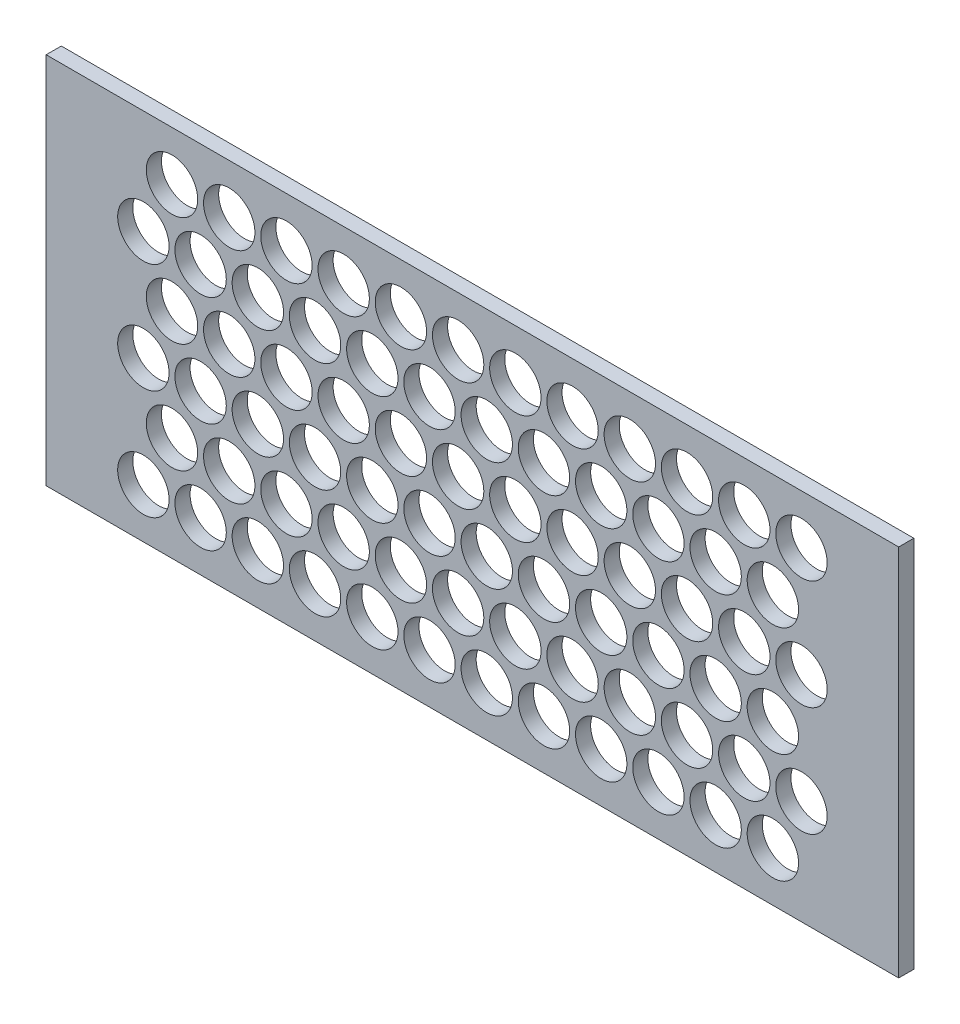
from build123d import *

# Parameters (mm, degrees)
SKETCH1_W                  = 357.55
SKETCH1_H                  = 156.55
BOSS_EXTRUDE1_DEPTH        = 6.35
CUT_EXTRUDE1_DEPTH         = 196.26340863
SKETCH4_R                  = 10.775
CUT_EXTRUDE2_DEPTH         = 196.26340863
LPATTERN1_COUNT            = 12
LPATTERN1_PITCH            = 24
LPATTERN2_COPY_1_DEPTH     = 196.26340863
LPATTERN2_COPY_2_DEPTH     = 196.26340863
LPATTERN2_COPY_3_DEPTH     = 196.26340863
LPATTERN2_COPY_4_DEPTH     = 196.26340863
LPATTERN2_COPY_5_DEPTH     = 196.26340863
LPATTERN2_COPY_6_DEPTH     = 196.26340863
LPATTERN2_COPY_7_DEPTH     = 196.26340863
LPATTERN2_COPY_8_DEPTH     = 196.26340863
LPATTERN2_COPY_9_DEPTH     = 196.26340863
LPATTERN2_COPY_10_DEPTH    = 196.26340863
LPATTERN2_COPY_11_DEPTH    = 196.26340863
LPATTERN2_COPY_12_DEPTH    = 196.26340863
LPATTERN2_COPY_13_DEPTH    = 196.26340863
LPATTERN2_COPY_14_DEPTH    = 196.26340863
LPATTERN2_COPY_15_DEPTH    = 196.26340863
LPATTERN2_COPY_16_DEPTH    = 196.26340863
LPATTERN2_COPY_17_DEPTH    = 196.26340863
LPATTERN2_COPY_18_DEPTH    = 196.26340863
LPATTERN2_COPY_19_DEPTH    = 196.26340863
LPATTERN2_COPY_20_DEPTH    = 196.26340863
LPATTERN2_COPY_21_DEPTH    = 196.26340863
LPATTERN2_COPY_22_DEPTH    = 196.26340863
LPATTERN2_COPY_23_SKETCH_R = 10.775
LPATTERN2_COPY_23_DEPTH    = 196.26340863
LPATTERN2_COPY_24_SKETCH_R = 10.775
LPATTERN2_COPY_24_DEPTH    = 196.26340863
LPATTERN2_COPY_25_SKETCH_R = 10.775
LPATTERN2_COPY_25_DEPTH    = 196.26340863
LPATTERN2_COPY_26_SKETCH_R = 10.775
LPATTERN2_COPY_26_DEPTH    = 196.26340863
LPATTERN2_COPY_27_SKETCH_R = 10.775
LPATTERN2_COPY_27_DEPTH    = 196.26340863
LPATTERN2_COPY_28_SKETCH_R = 10.775
LPATTERN2_COPY_28_DEPTH    = 196.26340863
LPATTERN2_COPY_29_SKETCH_R = 10.775
LPATTERN2_COPY_29_DEPTH    = 196.26340863
LPATTERN2_COPY_30_SKETCH_R = 10.775
LPATTERN2_COPY_30_DEPTH    = 196.26340863
LPATTERN2_COPY_31_SKETCH_R = 10.775
LPATTERN2_COPY_31_DEPTH    = 196.26340863
LPATTERN2_COPY_32_SKETCH_R = 10.775
LPATTERN2_COPY_32_DEPTH    = 196.26340863
LPATTERN2_COPY_33_SKETCH_R = 10.775
LPATTERN2_COPY_33_DEPTH    = 196.26340863
LPATTERN2_COPY_34_SKETCH_R = 10.775
LPATTERN2_COPY_34_DEPTH    = 196.26340863
LPATTERN2_COPY_35_SKETCH_R = 10.775
LPATTERN2_COPY_35_DEPTH    = 196.26340863
LPATTERN2_COPY_36_SKETCH_R = 10.775
LPATTERN2_COPY_36_DEPTH    = 196.26340863
LPATTERN2_COPY_37_SKETCH_R = 10.775
LPATTERN2_COPY_37_DEPTH    = 196.26340863
LPATTERN2_COPY_38_SKETCH_R = 10.775
LPATTERN2_COPY_38_DEPTH    = 196.26340863
LPATTERN2_COPY_39_SKETCH_R = 10.775
LPATTERN2_COPY_39_DEPTH    = 196.26340863
LPATTERN2_COPY_40_SKETCH_R = 10.775
LPATTERN2_COPY_40_DEPTH    = 196.26340863
LPATTERN2_COPY_41_SKETCH_R = 10.775
LPATTERN2_COPY_41_DEPTH    = 196.26340863
LPATTERN2_COPY_42_SKETCH_R = 10.775
LPATTERN2_COPY_42_DEPTH    = 196.26340863
LPATTERN2_COPY_43_SKETCH_R = 10.775
LPATTERN2_COPY_43_DEPTH    = 196.26340863
LPATTERN2_COPY_44_SKETCH_R = 10.775
LPATTERN2_COPY_44_DEPTH    = 196.26340863
LPATTERN2_COPY_45_DEPTH    = 196.26340863
LPATTERN2_COPY_46_DEPTH    = 196.26340863
LPATTERN2_COPY_47_SKETCH_R = 10.775
LPATTERN2_COPY_47_DEPTH    = 196.26340863
LPATTERN2_COPY_48_SKETCH_R = 10.775
LPATTERN2_COPY_48_DEPTH    = 196.26340863


with BuildPart() as part:
    # Sketch1 → Boss-Extrude1 (new body)
    with BuildSketch(Plane.XY):
        Rectangle(SKETCH1_W, SKETCH1_H)
    extrude(amount=BOSS_EXTRUDE1_DEPTH)

    # Sketch3 → Cut-Extrude1 (cut, through all)
    with BuildSketch(Plane.XY.offset(6.35)):
        with BuildLine():
            ThreePointArc((-127.225, -57.5), (-137.999999978, -46.725), (-148.775, -57.499999955))
            ThreePointArc((-148.775, -57.499999955), (-145.619075583, -65.119075551), (-138, -68.275))
            ThreePointArc((-138, -68.275), (-130.380924433, -65.119075567), (-127.225, -57.5))
        make_face()
    cut_extrude1 = extrude(amount=-CUT_EXTRUDE1_DEPTH, mode=Mode.SUBTRACT)

    # Sketch4 → Cut-Extrude2 (cut, through all)
    with BuildSketch(Plane.XY.offset(6.35)):
        with Locations((-126, -34.5)):
            Circle(SKETCH4_R)
    cut_extrude2 = extrude(amount=-CUT_EXTRUDE2_DEPTH, mode=Mode.SUBTRACT)

    # LPattern1: Cut-Extrude1, Cut-Extrude2 ×12
    with Locations(*[(i * LPATTERN1_PITCH, 0, 0) for i in range(1, LPATTERN1_COUNT)]):
        add(cut_extrude1, mode=Mode.SUBTRACT)
        add(cut_extrude2, mode=Mode.SUBTRACT)

    # LPattern2 copy 1 sketch → LPattern2 copy 1 (cut, through all)
    with BuildSketch(Plane(origin=(24, 46, 6.35), x_dir=(1, 0, 0), z_dir=(0, 0, 1))):
        with BuildLine():
            ThreePointArc((-127.225, -57.5), (-137.999999978, -46.725), (-148.775, -57.499999955))
            ThreePointArc((-148.775, -57.499999955), (-145.619075583, -65.119075551), (-138, -68.275))
            ThreePointArc((-138, -68.275), (-130.380924433, -65.119075567), (-127.225, -57.5))
        make_face()
    extrude(amount=-LPATTERN2_COPY_1_DEPTH, mode=Mode.SUBTRACT)

    # LPattern2 copy 2 sketch → LPattern2 copy 2 (cut, through all)
    with BuildSketch(Plane(origin=(24, 92, 6.35), x_dir=(1, 0, 0), z_dir=(0, 0, 1))):
        with BuildLine():
            ThreePointArc((-127.225, -57.5), (-137.999999978, -46.725), (-148.775, -57.499999955))
            ThreePointArc((-148.775, -57.499999955), (-145.619075583, -65.119075551), (-138, -68.275))
            ThreePointArc((-138, -68.275), (-130.380924433, -65.119075567), (-127.225, -57.5))
        make_face()
    extrude(amount=-LPATTERN2_COPY_2_DEPTH, mode=Mode.SUBTRACT)

    # LPattern2 copy 3 sketch → LPattern2 copy 3 (cut, through all)
    with BuildSketch(Plane(origin=(48, 46, 6.35), x_dir=(1, 0, 0), z_dir=(0, 0, 1))):
        with BuildLine():
            ThreePointArc((-127.225, -57.5), (-137.999999978, -46.725), (-148.775, -57.499999955))
            ThreePointArc((-148.775, -57.499999955), (-145.619075583, -65.119075551), (-138, -68.275))
            ThreePointArc((-138, -68.275), (-130.380924433, -65.119075567), (-127.225, -57.5))
        make_face()
    extrude(amount=-LPATTERN2_COPY_3_DEPTH, mode=Mode.SUBTRACT)

    # LPattern2 copy 4 sketch → LPattern2 copy 4 (cut, through all)
    with BuildSketch(Plane(origin=(48, 92, 6.35), x_dir=(1, 0, 0), z_dir=(0, 0, 1))):
        with BuildLine():
            ThreePointArc((-127.225, -57.5), (-137.999999978, -46.725), (-148.775, -57.499999955))
            ThreePointArc((-148.775, -57.499999955), (-145.619075583, -65.119075551), (-138, -68.275))
            ThreePointArc((-138, -68.275), (-130.380924433, -65.119075567), (-127.225, -57.5))
        make_face()
    extrude(amount=-LPATTERN2_COPY_4_DEPTH, mode=Mode.SUBTRACT)

    # LPattern2 copy 5 sketch → LPattern2 copy 5 (cut, through all)
    with BuildSketch(Plane(origin=(72, 46, 6.35), x_dir=(1, 0, 0), z_dir=(0, 0, 1))):
        with BuildLine():
            ThreePointArc((-127.225, -57.5), (-137.999999978, -46.725), (-148.775, -57.499999955))
            ThreePointArc((-148.775, -57.499999955), (-145.619075583, -65.119075551), (-138, -68.275))
            ThreePointArc((-138, -68.275), (-130.380924433, -65.119075567), (-127.225, -57.5))
        make_face()
    extrude(amount=-LPATTERN2_COPY_5_DEPTH, mode=Mode.SUBTRACT)

    # LPattern2 copy 6 sketch → LPattern2 copy 6 (cut, through all)
    with BuildSketch(Plane(origin=(72, 92, 6.35), x_dir=(1, 0, 0), z_dir=(0, 0, 1))):
        with BuildLine():
            ThreePointArc((-127.225, -57.5), (-137.999999978, -46.725), (-148.775, -57.499999955))
            ThreePointArc((-148.775, -57.499999955), (-145.619075583, -65.119075551), (-138, -68.275))
            ThreePointArc((-138, -68.275), (-130.380924433, -65.119075567), (-127.225, -57.5))
        make_face()
    extrude(amount=-LPATTERN2_COPY_6_DEPTH, mode=Mode.SUBTRACT)

    # LPattern2 copy 7 sketch → LPattern2 copy 7 (cut, through all)
    with BuildSketch(Plane(origin=(96, 46, 6.35), x_dir=(1, 0, 0), z_dir=(0, 0, 1))):
        with BuildLine():
            ThreePointArc((-127.225, -57.5), (-137.999999978, -46.725), (-148.775, -57.499999955))
            ThreePointArc((-148.775, -57.499999955), (-145.619075583, -65.119075551), (-138, -68.275))
            ThreePointArc((-138, -68.275), (-130.380924433, -65.119075567), (-127.225, -57.5))
        make_face()
    extrude(amount=-LPATTERN2_COPY_7_DEPTH, mode=Mode.SUBTRACT)

    # LPattern2 copy 8 sketch → LPattern2 copy 8 (cut, through all)
    with BuildSketch(Plane(origin=(96, 92, 6.35), x_dir=(1, 0, 0), z_dir=(0, 0, 1))):
        with BuildLine():
            ThreePointArc((-127.225, -57.5), (-137.999999978, -46.725), (-148.775, -57.499999955))
            ThreePointArc((-148.775, -57.499999955), (-145.619075583, -65.119075551), (-138, -68.275))
            ThreePointArc((-138, -68.275), (-130.380924433, -65.119075567), (-127.225, -57.5))
        make_face()
    extrude(amount=-LPATTERN2_COPY_8_DEPTH, mode=Mode.SUBTRACT)

    # LPattern2 copy 9 sketch → LPattern2 copy 9 (cut, through all)
    with BuildSketch(Plane(origin=(120, 46, 6.35), x_dir=(1, 0, 0), z_dir=(0, 0, 1))):
        with BuildLine():
            ThreePointArc((-127.225, -57.5), (-137.999999978, -46.725), (-148.775, -57.499999955))
            ThreePointArc((-148.775, -57.499999955), (-145.619075583, -65.119075551), (-138, -68.275))
            ThreePointArc((-138, -68.275), (-130.380924433, -65.119075567), (-127.225, -57.5))
        make_face()
    extrude(amount=-LPATTERN2_COPY_9_DEPTH, mode=Mode.SUBTRACT)

    # LPattern2 copy 10 sketch → LPattern2 copy 10 (cut, through all)
    with BuildSketch(Plane(origin=(120, 92, 6.35), x_dir=(1, 0, 0), z_dir=(0, 0, 1))):
        with BuildLine():
            ThreePointArc((-127.225, -57.5), (-137.999999978, -46.725), (-148.775, -57.499999955))
            ThreePointArc((-148.775, -57.499999955), (-145.619075583, -65.119075551), (-138, -68.275))
            ThreePointArc((-138, -68.275), (-130.380924433, -65.119075567), (-127.225, -57.5))
        make_face()
    extrude(amount=-LPATTERN2_COPY_10_DEPTH, mode=Mode.SUBTRACT)

    # LPattern2 copy 11 sketch → LPattern2 copy 11 (cut, through all)
    with BuildSketch(Plane(origin=(144, 46, 6.35), x_dir=(1, 0, 0), z_dir=(0, 0, 1))):
        with BuildLine():
            ThreePointArc((-127.225, -57.5), (-137.999999978, -46.725), (-148.775, -57.499999955))
            ThreePointArc((-148.775, -57.499999955), (-145.619075583, -65.119075551), (-138, -68.275))
            ThreePointArc((-138, -68.275), (-130.380924433, -65.119075567), (-127.225, -57.5))
        make_face()
    extrude(amount=-LPATTERN2_COPY_11_DEPTH, mode=Mode.SUBTRACT)

    # LPattern2 copy 12 sketch → LPattern2 copy 12 (cut, through all)
    with BuildSketch(Plane(origin=(144, 92, 6.35), x_dir=(1, 0, 0), z_dir=(0, 0, 1))):
        with BuildLine():
            ThreePointArc((-127.225, -57.5), (-137.999999978, -46.725), (-148.775, -57.499999955))
            ThreePointArc((-148.775, -57.499999955), (-145.619075583, -65.119075551), (-138, -68.275))
            ThreePointArc((-138, -68.275), (-130.380924433, -65.119075567), (-127.225, -57.5))
        make_face()
    extrude(amount=-LPATTERN2_COPY_12_DEPTH, mode=Mode.SUBTRACT)

    # LPattern2 copy 13 sketch → LPattern2 copy 13 (cut, through all)
    with BuildSketch(Plane(origin=(168, 46, 6.35), x_dir=(1, 0, 0), z_dir=(0, 0, 1))):
        with BuildLine():
            ThreePointArc((-127.225, -57.5), (-137.999999978, -46.725), (-148.775, -57.499999955))
            ThreePointArc((-148.775, -57.499999955), (-145.619075583, -65.119075551), (-138, -68.275))
            ThreePointArc((-138, -68.275), (-130.380924433, -65.119075567), (-127.225, -57.5))
        make_face()
    extrude(amount=-LPATTERN2_COPY_13_DEPTH, mode=Mode.SUBTRACT)

    # LPattern2 copy 14 sketch → LPattern2 copy 14 (cut, through all)
    with BuildSketch(Plane(origin=(168, 92, 6.35), x_dir=(1, 0, 0), z_dir=(0, 0, 1))):
        with BuildLine():
            ThreePointArc((-127.225, -57.5), (-137.999999978, -46.725), (-148.775, -57.499999955))
            ThreePointArc((-148.775, -57.499999955), (-145.619075583, -65.119075551), (-138, -68.275))
            ThreePointArc((-138, -68.275), (-130.380924433, -65.119075567), (-127.225, -57.5))
        make_face()
    extrude(amount=-LPATTERN2_COPY_14_DEPTH, mode=Mode.SUBTRACT)

    # LPattern2 copy 15 sketch → LPattern2 copy 15 (cut, through all)
    with BuildSketch(Plane(origin=(192, 46, 6.35), x_dir=(1, 0, 0), z_dir=(0, 0, 1))):
        with BuildLine():
            ThreePointArc((-127.225, -57.5), (-137.999999978, -46.725), (-148.775, -57.499999955))
            ThreePointArc((-148.775, -57.499999955), (-145.619075583, -65.119075551), (-138, -68.275))
            ThreePointArc((-138, -68.275), (-130.380924433, -65.119075567), (-127.225, -57.5))
        make_face()
    extrude(amount=-LPATTERN2_COPY_15_DEPTH, mode=Mode.SUBTRACT)

    # LPattern2 copy 16 sketch → LPattern2 copy 16 (cut, through all)
    with BuildSketch(Plane(origin=(192, 92, 6.35), x_dir=(1, 0, 0), z_dir=(0, 0, 1))):
        with BuildLine():
            ThreePointArc((-127.225, -57.5), (-137.999999978, -46.725), (-148.775, -57.499999955))
            ThreePointArc((-148.775, -57.499999955), (-145.619075583, -65.119075551), (-138, -68.275))
            ThreePointArc((-138, -68.275), (-130.380924433, -65.119075567), (-127.225, -57.5))
        make_face()
    extrude(amount=-LPATTERN2_COPY_16_DEPTH, mode=Mode.SUBTRACT)

    # LPattern2 copy 17 sketch → LPattern2 copy 17 (cut, through all)
    with BuildSketch(Plane(origin=(216, 46, 6.35), x_dir=(1, 0, 0), z_dir=(0, 0, 1))):
        with BuildLine():
            ThreePointArc((-127.225, -57.5), (-137.999999978, -46.725), (-148.775, -57.499999955))
            ThreePointArc((-148.775, -57.499999955), (-145.619075583, -65.119075551), (-138, -68.275))
            ThreePointArc((-138, -68.275), (-130.380924433, -65.119075567), (-127.225, -57.5))
        make_face()
    extrude(amount=-LPATTERN2_COPY_17_DEPTH, mode=Mode.SUBTRACT)

    # LPattern2 copy 18 sketch → LPattern2 copy 18 (cut, through all)
    with BuildSketch(Plane(origin=(216, 92, 6.35), x_dir=(1, 0, 0), z_dir=(0, 0, 1))):
        with BuildLine():
            ThreePointArc((-127.225, -57.5), (-137.999999978, -46.725), (-148.775, -57.499999955))
            ThreePointArc((-148.775, -57.499999955), (-145.619075583, -65.119075551), (-138, -68.275))
            ThreePointArc((-138, -68.275), (-130.380924433, -65.119075567), (-127.225, -57.5))
        make_face()
    extrude(amount=-LPATTERN2_COPY_18_DEPTH, mode=Mode.SUBTRACT)

    # LPattern2 copy 19 sketch → LPattern2 copy 19 (cut, through all)
    with BuildSketch(Plane(origin=(240, 46, 6.35), x_dir=(1, 0, 0), z_dir=(0, 0, 1))):
        with BuildLine():
            ThreePointArc((-127.225, -57.5), (-137.999999978, -46.725), (-148.775, -57.499999955))
            ThreePointArc((-148.775, -57.499999955), (-145.619075583, -65.119075551), (-138, -68.275))
            ThreePointArc((-138, -68.275), (-130.380924433, -65.119075567), (-127.225, -57.5))
        make_face()
    extrude(amount=-LPATTERN2_COPY_19_DEPTH, mode=Mode.SUBTRACT)

    # LPattern2 copy 20 sketch → LPattern2 copy 20 (cut, through all)
    with BuildSketch(Plane(origin=(240, 92, 6.35), x_dir=(1, 0, 0), z_dir=(0, 0, 1))):
        with BuildLine():
            ThreePointArc((-127.225, -57.5), (-137.999999978, -46.725), (-148.775, -57.499999955))
            ThreePointArc((-148.775, -57.499999955), (-145.619075583, -65.119075551), (-138, -68.275))
            ThreePointArc((-138, -68.275), (-130.380924433, -65.119075567), (-127.225, -57.5))
        make_face()
    extrude(amount=-LPATTERN2_COPY_20_DEPTH, mode=Mode.SUBTRACT)

    # LPattern2 copy 21 sketch → LPattern2 copy 21 (cut, through all)
    with BuildSketch(Plane(origin=(264, 46, 6.35), x_dir=(1, 0, 0), z_dir=(0, 0, 1))):
        with BuildLine():
            ThreePointArc((-127.225, -57.5), (-137.999999978, -46.725), (-148.775, -57.499999955))
            ThreePointArc((-148.775, -57.499999955), (-145.619075583, -65.119075551), (-138, -68.275))
            ThreePointArc((-138, -68.275), (-130.380924433, -65.119075567), (-127.225, -57.5))
        make_face()
    extrude(amount=-LPATTERN2_COPY_21_DEPTH, mode=Mode.SUBTRACT)

    # LPattern2 copy 22 sketch → LPattern2 copy 22 (cut, through all)
    with BuildSketch(Plane(origin=(264, 92, 6.35), x_dir=(1, 0, 0), z_dir=(0, 0, 1))):
        with BuildLine():
            ThreePointArc((-127.225, -57.5), (-137.999999978, -46.725), (-148.775, -57.499999955))
            ThreePointArc((-148.775, -57.499999955), (-145.619075583, -65.119075551), (-138, -68.275))
            ThreePointArc((-138, -68.275), (-130.380924433, -65.119075567), (-127.225, -57.5))
        make_face()
    extrude(amount=-LPATTERN2_COPY_22_DEPTH, mode=Mode.SUBTRACT)

    # LPattern2 copy 23 sketch → LPattern2 copy 23 (cut, through all)
    with BuildSketch(Plane(origin=(24, 46, 6.35), x_dir=(1, 0, 0), z_dir=(0, 0, 1))):
        with Locations((-126, -34.5)):
            Circle(LPATTERN2_COPY_23_SKETCH_R)
    extrude(amount=-LPATTERN2_COPY_23_DEPTH, mode=Mode.SUBTRACT)

    # LPattern2 copy 24 sketch → LPattern2 copy 24 (cut, through all)
    with BuildSketch(Plane(origin=(24, 92, 6.35), x_dir=(1, 0, 0), z_dir=(0, 0, 1))):
        with Locations((-126, -34.5)):
            Circle(LPATTERN2_COPY_24_SKETCH_R)
    extrude(amount=-LPATTERN2_COPY_24_DEPTH, mode=Mode.SUBTRACT)

    # LPattern2 copy 25 sketch → LPattern2 copy 25 (cut, through all)
    with BuildSketch(Plane(origin=(48, 46, 6.35), x_dir=(1, 0, 0), z_dir=(0, 0, 1))):
        with Locations((-126, -34.5)):
            Circle(LPATTERN2_COPY_25_SKETCH_R)
    extrude(amount=-LPATTERN2_COPY_25_DEPTH, mode=Mode.SUBTRACT)

    # LPattern2 copy 26 sketch → LPattern2 copy 26 (cut, through all)
    with BuildSketch(Plane(origin=(48, 92, 6.35), x_dir=(1, 0, 0), z_dir=(0, 0, 1))):
        with Locations((-126, -34.5)):
            Circle(LPATTERN2_COPY_26_SKETCH_R)
    extrude(amount=-LPATTERN2_COPY_26_DEPTH, mode=Mode.SUBTRACT)

    # LPattern2 copy 27 sketch → LPattern2 copy 27 (cut, through all)
    with BuildSketch(Plane(origin=(72, 46, 6.35), x_dir=(1, 0, 0), z_dir=(0, 0, 1))):
        with Locations((-126, -34.5)):
            Circle(LPATTERN2_COPY_27_SKETCH_R)
    extrude(amount=-LPATTERN2_COPY_27_DEPTH, mode=Mode.SUBTRACT)

    # LPattern2 copy 28 sketch → LPattern2 copy 28 (cut, through all)
    with BuildSketch(Plane(origin=(72, 92, 6.35), x_dir=(1, 0, 0), z_dir=(0, 0, 1))):
        with Locations((-126, -34.5)):
            Circle(LPATTERN2_COPY_28_SKETCH_R)
    extrude(amount=-LPATTERN2_COPY_28_DEPTH, mode=Mode.SUBTRACT)

    # LPattern2 copy 29 sketch → LPattern2 copy 29 (cut, through all)
    with BuildSketch(Plane(origin=(96, 46, 6.35), x_dir=(1, 0, 0), z_dir=(0, 0, 1))):
        with Locations((-126, -34.5)):
            Circle(LPATTERN2_COPY_29_SKETCH_R)
    extrude(amount=-LPATTERN2_COPY_29_DEPTH, mode=Mode.SUBTRACT)

    # LPattern2 copy 30 sketch → LPattern2 copy 30 (cut, through all)
    with BuildSketch(Plane(origin=(96, 92, 6.35), x_dir=(1, 0, 0), z_dir=(0, 0, 1))):
        with Locations((-126, -34.5)):
            Circle(LPATTERN2_COPY_30_SKETCH_R)
    extrude(amount=-LPATTERN2_COPY_30_DEPTH, mode=Mode.SUBTRACT)

    # LPattern2 copy 31 sketch → LPattern2 copy 31 (cut, through all)
    with BuildSketch(Plane(origin=(120, 46, 6.35), x_dir=(1, 0, 0), z_dir=(0, 0, 1))):
        with Locations((-126, -34.5)):
            Circle(LPATTERN2_COPY_31_SKETCH_R)
    extrude(amount=-LPATTERN2_COPY_31_DEPTH, mode=Mode.SUBTRACT)

    # LPattern2 copy 32 sketch → LPattern2 copy 32 (cut, through all)
    with BuildSketch(Plane(origin=(120, 92, 6.35), x_dir=(1, 0, 0), z_dir=(0, 0, 1))):
        with Locations((-126, -34.5)):
            Circle(LPATTERN2_COPY_32_SKETCH_R)
    extrude(amount=-LPATTERN2_COPY_32_DEPTH, mode=Mode.SUBTRACT)

    # LPattern2 copy 33 sketch → LPattern2 copy 33 (cut, through all)
    with BuildSketch(Plane(origin=(144, 46, 6.35), x_dir=(1, 0, 0), z_dir=(0, 0, 1))):
        with Locations((-126, -34.5)):
            Circle(LPATTERN2_COPY_33_SKETCH_R)
    extrude(amount=-LPATTERN2_COPY_33_DEPTH, mode=Mode.SUBTRACT)

    # LPattern2 copy 34 sketch → LPattern2 copy 34 (cut, through all)
    with BuildSketch(Plane(origin=(144, 92, 6.35), x_dir=(1, 0, 0), z_dir=(0, 0, 1))):
        with Locations((-126, -34.5)):
            Circle(LPATTERN2_COPY_34_SKETCH_R)
    extrude(amount=-LPATTERN2_COPY_34_DEPTH, mode=Mode.SUBTRACT)

    # LPattern2 copy 35 sketch → LPattern2 copy 35 (cut, through all)
    with BuildSketch(Plane(origin=(168, 46, 6.35), x_dir=(1, 0, 0), z_dir=(0, 0, 1))):
        with Locations((-126, -34.5)):
            Circle(LPATTERN2_COPY_35_SKETCH_R)
    extrude(amount=-LPATTERN2_COPY_35_DEPTH, mode=Mode.SUBTRACT)

    # LPattern2 copy 36 sketch → LPattern2 copy 36 (cut, through all)
    with BuildSketch(Plane(origin=(168, 92, 6.35), x_dir=(1, 0, 0), z_dir=(0, 0, 1))):
        with Locations((-126, -34.5)):
            Circle(LPATTERN2_COPY_36_SKETCH_R)
    extrude(amount=-LPATTERN2_COPY_36_DEPTH, mode=Mode.SUBTRACT)

    # LPattern2 copy 37 sketch → LPattern2 copy 37 (cut, through all)
    with BuildSketch(Plane(origin=(192, 46, 6.35), x_dir=(1, 0, 0), z_dir=(0, 0, 1))):
        with Locations((-126, -34.5)):
            Circle(LPATTERN2_COPY_37_SKETCH_R)
    extrude(amount=-LPATTERN2_COPY_37_DEPTH, mode=Mode.SUBTRACT)

    # LPattern2 copy 38 sketch → LPattern2 copy 38 (cut, through all)
    with BuildSketch(Plane(origin=(192, 92, 6.35), x_dir=(1, 0, 0), z_dir=(0, 0, 1))):
        with Locations((-126, -34.5)):
            Circle(LPATTERN2_COPY_38_SKETCH_R)
    extrude(amount=-LPATTERN2_COPY_38_DEPTH, mode=Mode.SUBTRACT)

    # LPattern2 copy 39 sketch → LPattern2 copy 39 (cut, through all)
    with BuildSketch(Plane(origin=(216, 46, 6.35), x_dir=(1, 0, 0), z_dir=(0, 0, 1))):
        with Locations((-126, -34.5)):
            Circle(LPATTERN2_COPY_39_SKETCH_R)
    extrude(amount=-LPATTERN2_COPY_39_DEPTH, mode=Mode.SUBTRACT)

    # LPattern2 copy 40 sketch → LPattern2 copy 40 (cut, through all)
    with BuildSketch(Plane(origin=(216, 92, 6.35), x_dir=(1, 0, 0), z_dir=(0, 0, 1))):
        with Locations((-126, -34.5)):
            Circle(LPATTERN2_COPY_40_SKETCH_R)
    extrude(amount=-LPATTERN2_COPY_40_DEPTH, mode=Mode.SUBTRACT)

    # LPattern2 copy 41 sketch → LPattern2 copy 41 (cut, through all)
    with BuildSketch(Plane(origin=(240, 46, 6.35), x_dir=(1, 0, 0), z_dir=(0, 0, 1))):
        with Locations((-126, -34.5)):
            Circle(LPATTERN2_COPY_41_SKETCH_R)
    extrude(amount=-LPATTERN2_COPY_41_DEPTH, mode=Mode.SUBTRACT)

    # LPattern2 copy 42 sketch → LPattern2 copy 42 (cut, through all)
    with BuildSketch(Plane(origin=(240, 92, 6.35), x_dir=(1, 0, 0), z_dir=(0, 0, 1))):
        with Locations((-126, -34.5)):
            Circle(LPATTERN2_COPY_42_SKETCH_R)
    extrude(amount=-LPATTERN2_COPY_42_DEPTH, mode=Mode.SUBTRACT)

    # LPattern2 copy 43 sketch → LPattern2 copy 43 (cut, through all)
    with BuildSketch(Plane(origin=(264, 46, 6.35), x_dir=(1, 0, 0), z_dir=(0, 0, 1))):
        with Locations((-126, -34.5)):
            Circle(LPATTERN2_COPY_43_SKETCH_R)
    extrude(amount=-LPATTERN2_COPY_43_DEPTH, mode=Mode.SUBTRACT)

    # LPattern2 copy 44 sketch → LPattern2 copy 44 (cut, through all)
    with BuildSketch(Plane(origin=(264, 92, 6.35), x_dir=(1, 0, 0), z_dir=(0, 0, 1))):
        with Locations((-126, -34.5)):
            Circle(LPATTERN2_COPY_44_SKETCH_R)
    extrude(amount=-LPATTERN2_COPY_44_DEPTH, mode=Mode.SUBTRACT)

    # LPattern2 copy 45 sketch → LPattern2 copy 45 (cut, through all)
    with BuildSketch(Plane(origin=(0, 46, 6.35), x_dir=(1, 0, 0), z_dir=(0, 0, 1))):
        with BuildLine():
            ThreePointArc((-127.225, -57.5), (-137.999999978, -46.725), (-148.775, -57.499999955))
            ThreePointArc((-148.775, -57.499999955), (-145.619075583, -65.119075551), (-138, -68.275))
            ThreePointArc((-138, -68.275), (-130.380924433, -65.119075567), (-127.225, -57.5))
        make_face()
    extrude(amount=-LPATTERN2_COPY_45_DEPTH, mode=Mode.SUBTRACT)

    # LPattern2 copy 46 sketch → LPattern2 copy 46 (cut, through all)
    with BuildSketch(Plane(origin=(0, 92, 6.35), x_dir=(1, 0, 0), z_dir=(0, 0, 1))):
        with BuildLine():
            ThreePointArc((-127.225, -57.5), (-137.999999978, -46.725), (-148.775, -57.499999955))
            ThreePointArc((-148.775, -57.499999955), (-145.619075583, -65.119075551), (-138, -68.275))
            ThreePointArc((-138, -68.275), (-130.380924433, -65.119075567), (-127.225, -57.5))
        make_face()
    extrude(amount=-LPATTERN2_COPY_46_DEPTH, mode=Mode.SUBTRACT)

    # LPattern2 copy 47 sketch → LPattern2 copy 47 (cut, through all)
    with BuildSketch(Plane(origin=(0, 46, 6.35), x_dir=(1, 0, 0), z_dir=(0, 0, 1))):
        with Locations((-126, -34.5)):
            Circle(LPATTERN2_COPY_47_SKETCH_R)
    extrude(amount=-LPATTERN2_COPY_47_DEPTH, mode=Mode.SUBTRACT)

    # LPattern2 copy 48 sketch → LPattern2 copy 48 (cut, through all)
    with BuildSketch(Plane(origin=(0, 92, 6.35), x_dir=(1, 0, 0), z_dir=(0, 0, 1))):
        with Locations((-126, -34.5)):
            Circle(LPATTERN2_COPY_48_SKETCH_R)
    extrude(amount=-LPATTERN2_COPY_48_DEPTH, mode=Mode.SUBTRACT)


solid = part.part
